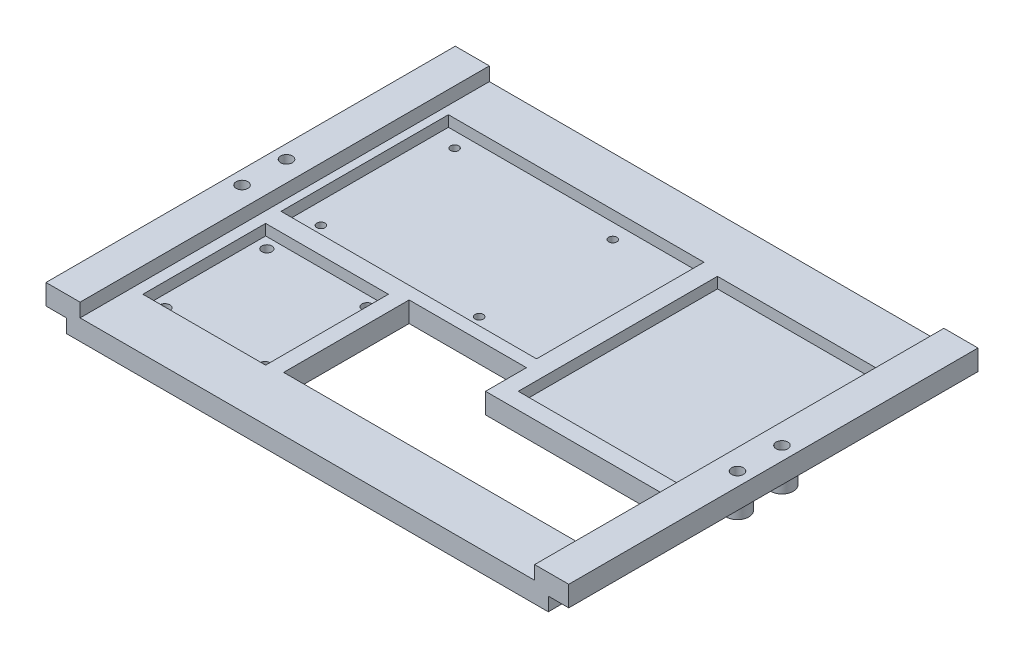
from build123d import *

# Parameters (mm, degrees)
PLATEFRAME_DEPTH          = 150
SKETCH3_R                 = 2.15
HOLESUPPORT_DEPTH         = 7.5
SKETCH4_R                 = 4.15
SKETCH4_R_2               = 2.15
CYLINDRICALSUPPORTS_DEPTH = 12.5
SKETCH5_W                 = 43
SKETCH5_H                 = 43
SKETCH5_W_2               = 89.65
SKETCH5_H_2               = 57.35
SKETCH5_W_3               = 58
SKETCH5_H_3               = 73
ITEMLAYOUT_DEPTH          = 4
HOLECUTOUT_DEPTH          = 7.5
SKETCH7_R                 = 1.5
HOLERASPBERRYPI_DEPTH     = 3.5
SKETCH8_R                 = 1.85
HOLEMOTORDRIVER_DEPTH     = 3.5
SKETCH10_W                = 45
SKETCH10_H                = 45
SKETCH10_W_2              = 43
SKETCH10_H_2              = 43
CUTMOTORDRIVER_DEPTH      = 4
SKETCH11_W                = 93.65
SKETCH11_H                = 61.35
SKETCH11_W_2              = 89.65
SKETCH11_H_2              = 57.35
CUTPASPBERRYPI_DEPTH      = 4


with BuildPart() as part:
    # Sketch2 → PlateFrame (new body)
    with BuildSketch(Plane.XY):
        Polygon((179.1, 12.5), (191.6, 12.5), (191.6, 5), (184.1, 5), (184.1, 0), (7.5, 0), (7.5, 5), (0, 5), (0, 12.5), (12.5, 12.5), (12.5, 7.5), (179.1, 7.5), align=None)
    extrude(amount=PLATEFRAME_DEPTH)

    # Sketch3 → HoleSupport (cut)
    with BuildSketch(Plane(origin=(0, 12.5, 0), x_dir=(1, 0, 0), z_dir=(0, 1, 0))):
        with Locations((5, -66.85)):
            Circle(SKETCH3_R)
        with Locations((5, -83.15)):
            Circle(SKETCH3_R)
        with Locations((186.6, -66.85)):
            Circle(SKETCH3_R)
        with Locations((186.6, -83.15)):
            Circle(SKETCH3_R)
    extrude(amount=-HOLESUPPORT_DEPTH, mode=Mode.SUBTRACT)

    # Sketch4 → CylindricalSupports (add)
    # profile 1 of 4: a face of its own
    with BuildSketch(Plane(origin=(0, 12.5, 0), x_dir=(1, 0, 0), z_dir=(0, 1, 0))):
        with Locations((186.6, -66.85)):
            Circle(SKETCH4_R)
        with Locations((186.6, -66.85)):
            Circle(SKETCH4_R_2, mode=Mode.SUBTRACT)
    # profile 2 of 4: a face of its own
    with BuildSketch(Plane(origin=(0, 12.5, 0), x_dir=(1, 0, 0), z_dir=(0, 1, 0))):
        with Locations((186.6, -83.15)):
            Circle(SKETCH4_R)
        with Locations((186.6, -83.15)):
            Circle(SKETCH4_R_2, mode=Mode.SUBTRACT)
    # profile 3 of 4: a face of its own
    with BuildSketch(Plane(origin=(0, 12.5, 0), x_dir=(1, 0, 0), z_dir=(0, 1, 0))):
        with Locations((5, -66.85)):
            Circle(SKETCH4_R)
        with Locations((5, -66.85)):
            Circle(SKETCH4_R_2, mode=Mode.SUBTRACT)
    # profile 4 of 4: a face of its own
    with BuildSketch(Plane(origin=(0, 12.5, 0), x_dir=(1, 0, 0), z_dir=(0, 1, 0))):
        with Locations((5, -83.15)):
            Circle(SKETCH4_R)
        with Locations((5, -83.15)):
            Circle(SKETCH4_R_2, mode=Mode.SUBTRACT)
    extrude(amount=-CYLINDRICALSUPPORTS_DEPTH)

    # Sketch5 → ItemLayout (cut)
    with BuildSketch(Plane(origin=(0, 7.5, 0), x_dir=(1, 0, 0), z_dir=(0, 1, 0))):
        with Locations((39, -108.5)):
            Rectangle(SKETCH5_W, SKETCH5_H)
        with Locations((62.325, -48.675)):
            Rectangle(SKETCH5_W_2, SKETCH5_H_2)
        with Locations((145.1, -56.5)):
            Rectangle(SKETCH5_W_3, SKETCH5_H_3)
    extrude(amount=-ITEMLAYOUT_DEPTH, mode=Mode.SUBTRACT)

    # Sketch6 → HoleCutout (cut)
    with BuildSketch(Plane(origin=(0, 7.5, 0), x_dir=(1, 0, 0), z_dir=(0, 1, 0))):
        Polygon((67.1, -84), (110.1, -84), (110.1, -99), (174.1, -99), (174.1, -130), (110.1, -130), (67.1, -130), align=None)
    extrude(amount=-HOLECUTOUT_DEPTH, mode=Mode.SUBTRACT)

    # Sketch7 → HoleRaspberryPi (cut)
    with BuildSketch(Plane(origin=(0, 3.5, 0), x_dir=(1, 0, 0), z_dir=(0, 1, 0))):
        with Locations((23.26, -23.5)):
            Circle(SKETCH7_R)
        with Locations((23.26, -72.5)):
            Circle(SKETCH7_R)
        with Locations((81.26, -72.5)):
            Circle(SKETCH7_R)
        with Locations((81.26, -23.5)):
            Circle(SKETCH7_R)
    extrude(amount=-HOLERASPBERRYPI_DEPTH, mode=Mode.SUBTRACT)

    # Sketch8 → HoleMotorDriver (cut)
    with BuildSketch(Plane(origin=(0, 3.5, 0), x_dir=(1, 0, 0), z_dir=(0, 1, 0))):
        with Locations((57.56, -127.24)):
            Circle(SKETCH8_R)
        with Locations((57.56, -89.86)):
            Circle(SKETCH8_R)
        with Locations((20.81, -89.86)):
            Circle(SKETCH8_R)
        with Locations((20.81, -127.24)):
            Circle(SKETCH8_R)
    extrude(amount=-HOLEMOTORDRIVER_DEPTH, mode=Mode.SUBTRACT)

    # Sketch10 → CutMotorDriver (cut)
    with BuildSketch(Plane(origin=(0, 7.5, 0), x_dir=(1, 0, 0), z_dir=(0, 1, 0))):
        with Locations((39, -108.5)):
            Rectangle(SKETCH10_W, SKETCH10_H)
        with Locations((39, -108.5)):
            Rectangle(SKETCH10_W_2, SKETCH10_H_2, mode=Mode.SUBTRACT)
    extrude(amount=-CUTMOTORDRIVER_DEPTH, mode=Mode.SUBTRACT)

    # Sketch11 → CutPaspberryPi (cut)
    with BuildSketch(Plane(origin=(0, 7.5, 0), x_dir=(1, 0, 0), z_dir=(0, 1, 0))):
        with Locations((62.325, -48.675)):
            Rectangle(SKETCH11_W, SKETCH11_H)
        with Locations((62.325, -48.675)):
            Rectangle(SKETCH11_W_2, SKETCH11_H_2, mode=Mode.SUBTRACT)
    extrude(amount=-CUTPASPBERRYPI_DEPTH, mode=Mode.SUBTRACT)


solid = part.part
